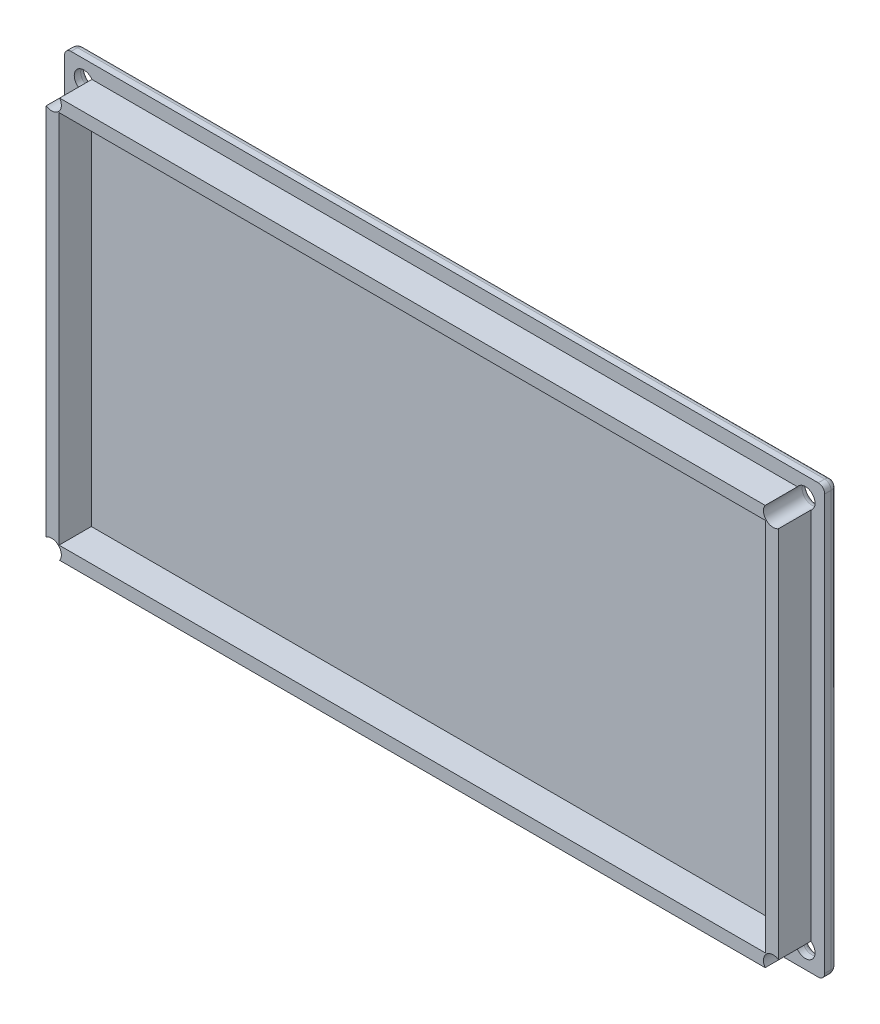
from build123d import *

# Parameters (mm, degrees)
BOSS_EXTRUDE1_DEPTH                        = 2
SKETCH2_W                                  = 113.60000000000001
SKETCH2_H                                  = 62.1
SKETCH2_W_2                                = 109.60000000000001
SKETCH2_H_2                                = 58.1
BOSS_EXTRUDE2_DEPTH                        = 5
SKETCH3_R                                  = 1.5000000000000042
CUT_EXTRUDE2_DEPTH                         = 71.85433681838424
MIRROR3_AT_THE_SECOND_PLANE_COPY_1_SKETC_R = 1.5000000000000042
MIRROR3_AT_THE_SECOND_PLANE_COPY_1_DEPTH   = 71.85433681838424
FILLET1_R                                  = 1
FILLET2_R                                  = 1


with BuildPart() as part:
    # Sketch1 → Boss-Extrude1 (new body)
    with BuildSketch(Plane.XY):
        Polygon((-55.697933748362985, 33.2), (62.20206625163701, 33.2), (62.202066251637014, -33.2), (-55.697933748362985, -33.2), align=None)
    extrude(amount=BOSS_EXTRUDE1_DEPTH)

    # Sketch2 → Boss-Extrude2 (add)
    with BuildSketch(Plane.XY.offset(2)):
        with Locations((3.252066251637011, 0)):
            Rectangle(SKETCH2_W, SKETCH2_H)
        with Locations((3.252066251637011, 0)):
            Rectangle(SKETCH2_W_2, SKETCH2_H_2, mode=Mode.SUBTRACT)
    extrude(amount=BOSS_EXTRUDE2_DEPTH)

    # Sketch3 → Cut-Extrude2 (cut, symmetric)
    with BuildSketch(Plane(origin=(0, 0, 0), x_dir=(-1, 0, 0), z_dir=(0, 0, -1))):
        with Locations(Location((-59.202066251637, 30.200000000000003, 0), (0, 0, 34.518107841))):
            Circle(SKETCH3_R)
    cut_extrude2 = extrude(amount=CUT_EXTRUDE2_DEPTH, both=True, mode=Mode.SUBTRACT)

    # Mirror2: Cut-Extrude2 across plane
    add(cut_extrude2.mirror(Plane.ZX), mode=Mode.SUBTRACT)

    # Mirror3: Cut-Extrude2 across plane
    add(cut_extrude2.mirror(Plane.ZX), mode=Mode.SUBTRACT)

    # Mirror3 at the second plane: Cut-Extrude2 across plane
    add(cut_extrude2.mirror(Plane(origin=(3.2520662516370114, 0, 0), x_dir=(0, 0, 1), z_dir=(1, 0, 0))), mode=Mode.SUBTRACT)

    # Mirror3 at the second plane copy 1 sketc → Mirror3 at the second plane copy 1 (cut, symmetric)
    with BuildSketch(Plane(origin=(6.504132503274023, 0, 0), x_dir=(1, 0, 0), z_dir=(0, 0, -1))):
        with Locations(Location((-59.202066251637, 30.200000000000003, 0), (0, 0, 34.518107841))):
            Circle(MIRROR3_AT_THE_SECOND_PLANE_COPY_1_SKETC_R)
    extrude(amount=MIRROR3_AT_THE_SECOND_PLANE_COPY_1_DEPTH, both=True, mode=Mode.SUBTRACT)

    # Fillet1
    fillet1_edges = [part.edges().sort_by_distance(p)[0] for p in [
        (62.202066251637014, -33.2, 1),
        (-55.697933748362985, -33.2, 1),
        (-55.697933748362985, 33.2, 1),
        (62.20206625163701, 33.2, 1),
    ]]
    fillet(fillet1_edges, radius=FILLET1_R)

    # Fillet2
    # the kernel refuses this fillet: 1 mm, written as the material it takes off along each edge
    with BuildSketch(Plane(origin=(62.20206625163701, 32.2, 0), x_dir=(-1, -1.1e-16, 0), z_dir=(1.1e-16, -1, 0)), Plane(origin=(-55.697933748362985, -32.2, 0), x_dir=(1, 0, 0), z_dir=(0, 1, 0))) as fillet2_piece_1:
        with BuildLine():
            CenterArc((FILLET2_R, -FILLET2_R), FILLET2_R, 90, 90)
            Line((0, -FILLET2_R), (0, 0))
            Line((0, 0), (FILLET2_R, 0))
        make_face()
    extrude(amount=64.4, mode=Mode.SUBTRACT)
    with BuildSketch(Plane(origin=(61.202066251637014, -33.2, 0), x_dir=(0, 1, 0), z_dir=(-1, 0, 0))) as fillet2_piece_2:
        with BuildLine():
            CenterArc((FILLET2_R, -FILLET2_R), FILLET2_R, 90, 90)
            Line((0, -FILLET2_R), (0, 0))
            Line((0, 0), (FILLET2_R, 0))
        make_face()
    extrude(amount=115.9, mode=Mode.SUBTRACT)
    with BuildSketch(Plane(origin=(-54.697933748362985, 33.2, 0), x_dir=(0, 0, 1), z_dir=(1, 0, 0))) as fillet2_piece_3:
        with BuildLine():
            CenterArc((FILLET2_R, FILLET2_R), FILLET2_R, 180, 90)
            Line((-1.1e-16, FILLET2_R), (0, 0))
            Line((0, 0), (FILLET2_R, 0))
        make_face()
    extrude(amount=115.89999999999999, mode=Mode.SUBTRACT)
    with BuildSketch(Plane(origin=(-54.697933748362985, -32.2, 0), x_dir=(-1, 0, 0), z_dir=(0, 1, 0))) as fillet2_piece_4:
        with BuildLine():
            CenterArc((1 - FILLET2_R, FILLET2_R), FILLET2_R, 270, 90)
            Line((1, FILLET2_R), (1, 0))
            Line((1, 0), (1 - FILLET2_R, 0))
        make_face()
    revolve(axis=Axis((-54.697933748362985, -32.2, 0), (0, 0, 1)), revolution_arc=90, mode=Mode.SUBTRACT)
    with BuildSketch(Plane(origin=(-54.697933748362985, 32.2, 0), x_dir=(0, 1, 0), z_dir=(1, 0, 0))) as fillet2_piece_5:
        with BuildLine():
            CenterArc((1 - FILLET2_R, FILLET2_R), FILLET2_R, 270, 90)
            Line((1, FILLET2_R), (1, 0))
            Line((1, 0), (1 - FILLET2_R, 0))
        make_face()
    revolve(axis=Axis((-54.697933748362985, 32.2, 0), (0, 0, 1)), revolution_arc=90, mode=Mode.SUBTRACT)
    with BuildSketch(Plane(origin=(61.20206625163701, 32.2, 0), x_dir=(0, 1, 0), z_dir=(-1, 0, 0))) as fillet2_piece_6:
        with BuildLine():
            CenterArc((1 - FILLET2_R, -FILLET2_R), FILLET2_R, 6.36e-15, 90)
            Line((1, -FILLET2_R), (1, 0))
            Line((1, 0), (1 - FILLET2_R, 0))
        make_face()
    revolve(axis=Axis((61.20206625163701, 32.2, 0), (0, 0, -1)), revolution_arc=90, mode=Mode.SUBTRACT)
    with BuildSketch(Plane(origin=(61.202066251637014, -32.2, 0), x_dir=(1, 0, 0), z_dir=(0, 1, 0))) as fillet2_piece_7:
        with BuildLine():
            CenterArc((1 - FILLET2_R, -FILLET2_R), FILLET2_R, 6.36e-15, 90)
            Line((1, -FILLET2_R), (1, 0))
            Line((1, 0), (1 - FILLET2_R, 0))
        make_face()
    revolve(axis=Axis((61.202066251637014, -32.2, 0), (0, 0, -1)), revolution_arc=90, mode=Mode.SUBTRACT)
    with BuildSketch(Plane(origin=(59.202066251637, 30.200000000000003, 0), x_dir=(-0.8239471396211576, 0.5666666666657856, 0), z_dir=(-0.5666666666657856, -0.8239471396211576, 0))) as fillet2_piece_8:
        with BuildLine():
            CenterArc((1.5000000000000024 + FILLET2_R, -FILLET2_R), FILLET2_R, 90, 90)
            Line((1.5000000000000024, -FILLET2_R), (1.5000000000000024, 0))
            Line((1.5000000000000024, 0), (1.5000000000000024 + FILLET2_R, 0))
        make_face()
    revolve(axis=Axis((59.202066251637, 30.200000000000003, 0), (0, 0, -1)), mode=Mode.SUBTRACT)
    with BuildSketch(Plane(origin=(59.202066251637, -30.200000000000003, 0), x_dir=(-0.8239471396211576, -0.5666666666657856, 0), z_dir=(0.5666666666657856, -0.8239471396211576, 0))) as fillet2_piece_9:
        with BuildLine():
            CenterArc((1.5000000000000024 + FILLET2_R, -FILLET2_R), FILLET2_R, 90, 90)
            Line((1.5000000000000024, -FILLET2_R), (1.5000000000000024, 0))
            Line((1.5000000000000024, 0), (1.5000000000000024 + FILLET2_R, 0))
        make_face()
    revolve(axis=Axis((59.202066251637, -30.200000000000003, 0), (0, 0, -1)), mode=Mode.SUBTRACT)
    with BuildSketch(Plane(origin=(-52.69793374836298, 30.200000000000003, 0), x_dir=(0.8239471396211576, 0.5666666666657856, 0), z_dir=(-0.5666666666657856, 0.8239471396211576, 0))) as fillet2_piece_10:
        with BuildLine():
            CenterArc((1.5000000000000024 + FILLET2_R, -FILLET2_R), FILLET2_R, 90, 90)
            Line((1.5000000000000062, -FILLET2_R), (1.5000000000000024, 0))
            Line((1.5000000000000024, 0), (1.5000000000000024 + FILLET2_R, 0))
        make_face()
    revolve(axis=Axis((-52.69793374836298, 30.200000000000003, 0), (0, 0, -1)), mode=Mode.SUBTRACT)
    with BuildSketch(Plane(origin=(-52.69793374836298, -30.200000000000003, 0), x_dir=(0.8239471396211576, -0.5666666666657856, 0), z_dir=(0.5666666666657856, 0.8239471396211576, 0))) as fillet2_piece_11:
        with BuildLine():
            CenterArc((1.5000000000000024 + FILLET2_R, -FILLET2_R), FILLET2_R, 90, 90)
            Line((1.5000000000000062, -FILLET2_R), (1.5000000000000024, 0))
            Line((1.5000000000000024, 0), (1.5000000000000024 + FILLET2_R, 0))
        make_face()
    revolve(axis=Axis((-52.69793374836298, -30.200000000000003, 0), (0, 0, -1)), mode=Mode.SUBTRACT)


solid = part.part
